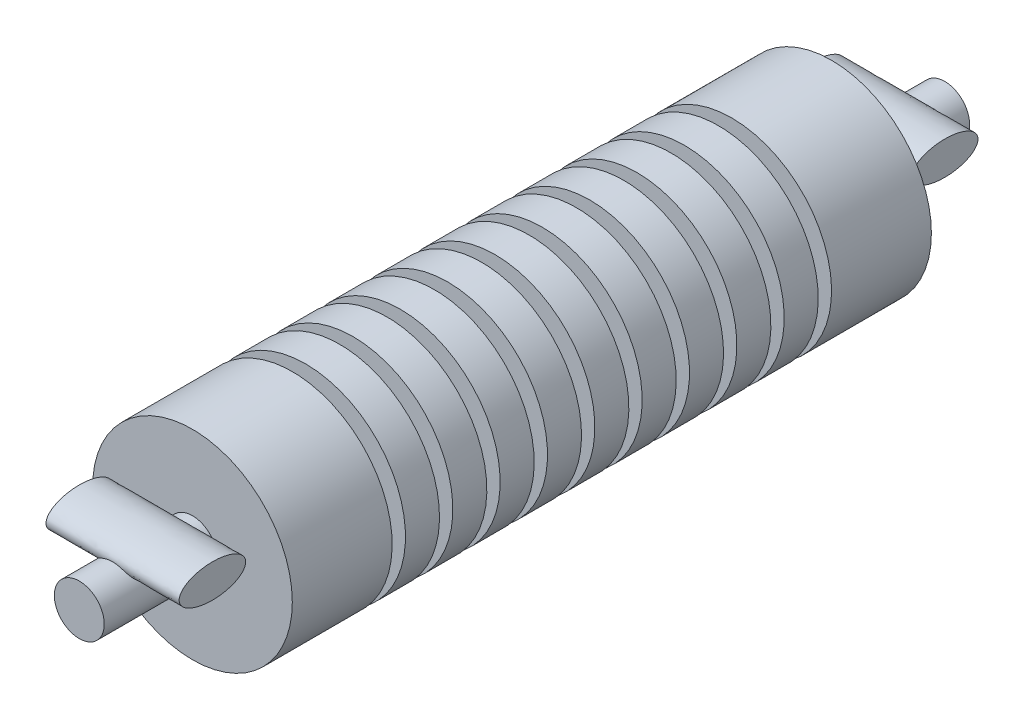
from build123d import *

# Parameters (mm, degrees)
SKETCH1_R               = 1.5
BOSS_EXTRUDE1_DEPTH     = 4.8
CUT_EXTRUDE1_DEPTH      = 6.247856705
CUT_EXTRUDE1_DEPTH_BACK = 6.247856705
SKETCH2_W               = 0.2
SKETCH2_H               = 3
SKETCH3_R               = 0.375
BOSS_EXTRUDE2_DEPTH     = 6.5
SKETCH4_RX              = 0.5
SKETCH4_RY              = 0.25
BOSS_EXTRUDE3_DEPTH     = 1


with BuildPart() as part:
    # Sketch1 → Boss-Extrude1 (new, symmetric)
    with BuildSketch(Plane.XY):
        Circle(SKETCH1_R)
    extrude(amount=BOSS_EXTRUDE1_DEPTH, both=True)

    # Sketch2 → Cut-Extrude1 (cut, two sides: drawn at the far end of the back side and taken through both)
    with BuildSketch(Plane(origin=(0, 0, 0), x_dir=(0, 0, -1), z_dir=(1, 0, 0)).offset(-CUT_EXTRUDE1_DEPTH_BACK)):
        with Locations((-3.2, 0)):
            Rectangle(SKETCH2_W, SKETCH2_H)
        with Locations((-2.488888889, 0)):
            Rectangle(SKETCH2_W, SKETCH2_H)
        with Locations((-1.777777778, 0)):
            Rectangle(SKETCH2_W, SKETCH2_H)
        with Locations((-1.066666667, 0)):
            Rectangle(SKETCH2_W, SKETCH2_H)
        with Locations((-0.355555556, 0)):
            Rectangle(SKETCH2_W, SKETCH2_H)
        with Locations((0.355555556, 0)):
            Rectangle(SKETCH2_W, SKETCH2_H)
        with Locations((1.066666667, 0)):
            Rectangle(SKETCH2_W, SKETCH2_H)
        with Locations((1.777777778, 0)):
            Rectangle(SKETCH2_W, SKETCH2_H)
        with Locations((2.488888889, 0)):
            Rectangle(SKETCH2_W, SKETCH2_H)
        with Locations((3.2, 0)):
            Rectangle(SKETCH2_W, SKETCH2_H)
    extrude(amount=CUT_EXTRUDE1_DEPTH + CUT_EXTRUDE1_DEPTH_BACK, mode=Mode.SUBTRACT)


with BuildPart() as cut_extrude1_piece_1:
    # of the separate pieces the step leaves, piece 1, a body of its own (cut_extrude1_pieces)
    add(part.part.solids().sort_by_distance((1.5, 0, -4.8))[0])



with BuildPart() as cut_extrude1_piece_2:
    # of the separate pieces the step leaves, piece 2, a body of its own (cut_extrude1_pieces)
    add(part.part.solids().sort_by_distance((1.5, 0, 3.3))[0])


with BuildPart() as cut_extrude1_piece_3:
    # of the separate pieces the step leaves, piece 3, a body of its own (cut_extrude1_pieces)
    add(part.part.solids().sort_by_distance((1.5, 0, 2.588888889))[0])


with BuildPart() as cut_extrude1_piece_4:
    # of the separate pieces the step leaves, piece 4, a body of its own (cut_extrude1_pieces)
    add(part.part.solids().sort_by_distance((1.5, 0, -1.677777778))[0])


with BuildPart() as cut_extrude1_piece_5:
    # of the separate pieces the step leaves, piece 5, a body of its own (cut_extrude1_pieces)
    add(part.part.solids().sort_by_distance((1.5, 0, -3.1))[0])


with BuildPart() as cut_extrude1_piece_6:
    # of the separate pieces the step leaves, piece 6, a body of its own (cut_extrude1_pieces)
    add(part.part.solids().sort_by_distance((1.5, 0, -2.388888889))[0])


with BuildPart() as cut_extrude1_piece_7:
    # of the separate pieces the step leaves, piece 7, a body of its own (cut_extrude1_pieces)
    add(part.part.solids().sort_by_distance((1.5, 0, 0.455555556))[0])


with BuildPart() as cut_extrude1_piece_8:
    # of the separate pieces the step leaves, piece 8, a body of its own (cut_extrude1_pieces)
    add(part.part.solids().sort_by_distance((1.5, 0, -0.255555556))[0])


with BuildPart() as cut_extrude1_piece_9:
    # of the separate pieces the step leaves, piece 9, a body of its own (cut_extrude1_pieces)
    add(part.part.solids().sort_by_distance((1.5, 0, 1.877777778))[0])


with BuildPart() as cut_extrude1_piece_10:
    # of the separate pieces the step leaves, piece 10, a body of its own (cut_extrude1_pieces)
    add(part.part.solids().sort_by_distance((1.5, 0, 1.166666667))[0])


with BuildPart() as cut_extrude1_piece_11:
    # of the separate pieces the step leaves, piece 11, a body of its own (cut_extrude1_pieces)
    add(part.part.solids().sort_by_distance((1.5, 0, -0.966666667))[0])


with BuildPart() as cut_extrude1_piece_1_1:
    add(cut_extrude1_piece_1.part)

    add(cut_extrude1_piece_2.part)  # Boss-Extrude2 merges Cut-Extrude1 piece 2

    add(cut_extrude1_piece_3.part)  # Boss-Extrude2 merges Cut-Extrude1 piece 3

    add(cut_extrude1_piece_4.part)  # Boss-Extrude2 merges Cut-Extrude1 piece 4

    add(cut_extrude1_piece_5.part)  # Boss-Extrude2 merges Cut-Extrude1 piece 5

    add(cut_extrude1_piece_6.part)  # Boss-Extrude2 merges Cut-Extrude1 piece 6

    add(cut_extrude1_piece_7.part)  # Boss-Extrude2 merges Cut-Extrude1 piece 7

    add(cut_extrude1_piece_8.part)  # Boss-Extrude2 merges Cut-Extrude1 piece 8

    add(cut_extrude1_piece_9.part)  # Boss-Extrude2 merges Cut-Extrude1 piece 9

    add(cut_extrude1_piece_10.part)  # Boss-Extrude2 merges Cut-Extrude1 piece 10

    add(cut_extrude1_piece_11.part)  # Boss-Extrude2 merges Cut-Extrude1 piece 11
    # Sketch3 → Boss-Extrude2 (add, symmetric)
    with BuildSketch(Plane.XY):
        Circle(SKETCH3_R)
    extrude(amount=BOSS_EXTRUDE2_DEPTH, both=True)

    # Sketch4 → Boss-Extrude3 (add, symmetric)
    with BuildSketch(Plane(origin=(0, 0, 0), x_dir=(0, 0, -1), z_dir=(1, 0, 0))):
        with Locations((-5.5, 0.375)):
            Ellipse(SKETCH4_RX, SKETCH4_RY)
        with Locations(Location((5.5, 0.375), (0, 0, 180))):
            Ellipse(SKETCH4_RX, SKETCH4_RY)
    extrude(amount=BOSS_EXTRUDE3_DEPTH, both=True)


solid = cut_extrude1_piece_1_1.part
